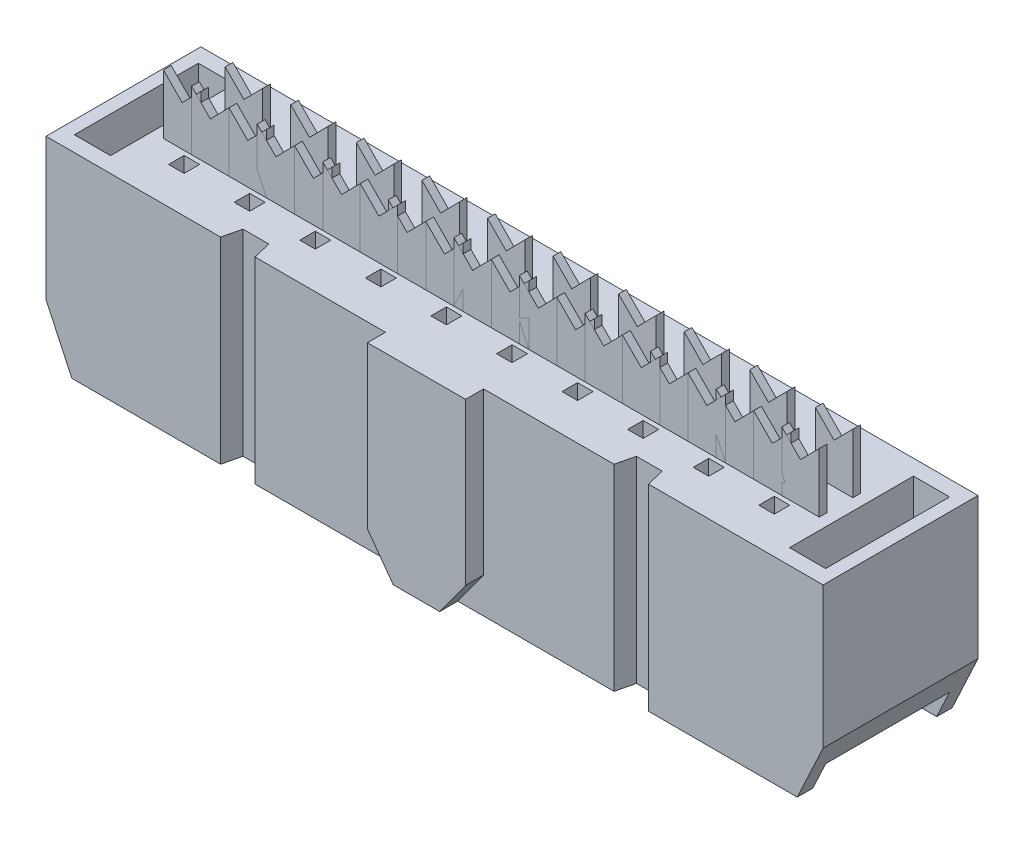
from build123d import *

# Parameters (mm, degrees)
SKETCH_10_W               = 1.4
SKETCH_10_H               = 4.8
SKETCH_10_W_2             = 0.6
SKETCH_10_H_2             = 0.6
EXTRUDE_4_DEPTH           = 7.62
CHAMFER_1_SIZE            = 2.144506921
CHAMFER_1_SIZE_2          = 1
CHAMFER_2_SIZE            = 1
CHAMFER_2_SIZE2           = 1.37638192
CHAMFER_4_SIZE            = 0.25
SKETCH_17_W               = 1.45
SKETCH_17_H               = 0.3
EXTRUDE_9_DEPTH           = 2.3
CUT_EXTRUDE_2_DEPTH       = 2.3
PATTERN_START             = 0.5
PATTERN_SKETCH_1_DEPTH    = 0.3
PATTERN_SKETCH_1_2_DEPTH  = 0.3
PATTERN_SKETCH_1_3_DEPTH  = 0.3
PATTERN_SKETCH_1_4_DEPTH  = 0.3
PATTERN_SKETCH_1_5_DEPTH  = 0.3
PATTERN_SKETCH_1_6_DEPTH  = 0.3
PATTERN_SKETCH_1_7_DEPTH  = 0.3
PATTERN_SKETCH_1_8_DEPTH  = 0.3
PATTERN_SKETCH_1_9_DEPTH  = 0.3
PATTERN_SKETCH_1_10_DEPTH = 0.3


# Read off the part's stored shape, not the designer's step: Эскиз-Массив1
with BuildPart() as part:
    # Эскиз10 → Бобышка-Вытянуть4 (new body)
    with BuildSketch(Plane(origin=(0, 0, 0), x_dir=(1, 0, 0), z_dir=(0, 1, 0))):
        Polygon((-15.05, -3), (-8.286666667, -3), (-8.12, -2.3), (-7.12, -2.3), (-6.953333333, -3), (-1.9, -3), (-1.9, -3.7), (1.9, -3.7), (1.9, -3), (6.953333333, -3), (7.12, -2.3), (8.12, -2.3), (8.286666667, -3), (15.05, -3), (15.05, 3), (-15.05, 3), align=None)
        with Locations((-13.85, 0)):
            Rectangle(SKETCH_10_W, SKETCH_10_H, mode=Mode.SUBTRACT)
        with Locations((-3.81, 1.27)):
            Rectangle(SKETCH_10_W_2, SKETCH_10_H_2, mode=Mode.SUBTRACT)
        with Locations((-1.27, 1.27)):
            Rectangle(SKETCH_10_W_2, SKETCH_10_H_2, mode=Mode.SUBTRACT)
        with Locations((-6.35, 1.27)):
            Rectangle(SKETCH_10_W_2, SKETCH_10_H_2, mode=Mode.SUBTRACT)
        with Locations((-8.89, 1.27)):
            Rectangle(SKETCH_10_W_2, SKETCH_10_H_2, mode=Mode.SUBTRACT)
        with Locations((-11.43, 1.27)):
            Rectangle(SKETCH_10_W_2, SKETCH_10_H_2, mode=Mode.SUBTRACT)
        with Locations((-11.43, -1.27)):
            Rectangle(SKETCH_10_W_2, SKETCH_10_H_2, mode=Mode.SUBTRACT)
        with Locations((-8.89, -1.27)):
            Rectangle(SKETCH_10_W_2, SKETCH_10_H_2, mode=Mode.SUBTRACT)
        with Locations((-6.35, -1.27)):
            Rectangle(SKETCH_10_W_2, SKETCH_10_H_2, mode=Mode.SUBTRACT)
        with Locations((-3.81, -1.27)):
            Rectangle(SKETCH_10_W_2, SKETCH_10_H_2, mode=Mode.SUBTRACT)
        with Locations((-1.27, -1.27)):
            Rectangle(SKETCH_10_W_2, SKETCH_10_H_2, mode=Mode.SUBTRACT)
        with Locations((3.81, -1.27)):
            Rectangle(SKETCH_10_W_2, SKETCH_10_H_2, mode=Mode.SUBTRACT)
        with Locations((1.27, -1.27)):
            Rectangle(SKETCH_10_W_2, SKETCH_10_H_2, mode=Mode.SUBTRACT)
        with Locations((6.35, -1.27)):
            Rectangle(SKETCH_10_W_2, SKETCH_10_H_2, mode=Mode.SUBTRACT)
        with Locations((8.89, -1.27)):
            Rectangle(SKETCH_10_W_2, SKETCH_10_H_2, mode=Mode.SUBTRACT)
        with Locations((11.43, -1.27)):
            Rectangle(SKETCH_10_W_2, SKETCH_10_H_2, mode=Mode.SUBTRACT)
        with Locations((11.43, 1.27)):
            Rectangle(SKETCH_10_W_2, SKETCH_10_H_2, mode=Mode.SUBTRACT)
        with Locations((8.89, 1.27)):
            Rectangle(SKETCH_10_W_2, SKETCH_10_H_2, mode=Mode.SUBTRACT)
        with Locations((6.35, 1.27)):
            Rectangle(SKETCH_10_W_2, SKETCH_10_H_2, mode=Mode.SUBTRACT)
        with Locations((3.81, 1.27)):
            Rectangle(SKETCH_10_W_2, SKETCH_10_H_2, mode=Mode.SUBTRACT)
        with Locations((1.27, 1.27)):
            Rectangle(SKETCH_10_W_2, SKETCH_10_H_2, mode=Mode.SUBTRACT)
        with Locations((13.85, 0)):
            Rectangle(SKETCH_10_W, SKETCH_10_H, mode=Mode.SUBTRACT)
    extrude(amount=EXTRUDE_4_DEPTH)

    # Фаска1
    # the kernel refuses this chamfer: 2.144506921, 1 mm, written as the material it takes off along each edge
    with BuildSketch(Plane(origin=(15.05, 0, 8.556364829), x_dir=(0.016311164131110077, 0.9998669641130705, 0), z_dir=(0, 0, -1)), Plane(origin=(-15.05, 0, -8.556364829), x_dir=(-0.016311164131110077, 0.9998669641130705, 0), z_dir=(0, 0, 1))) as chamfer_1_piece_1:
        Polygon((CHAMFER_1_SIZE * 0.999866963884, -CHAMFER_1_SIZE * 0.0163111641274), (-CHAMFER_1_SIZE_2 * 0.0163111641311, -CHAMFER_1_SIZE_2 * 0.999866964113), (0, 0), align=None)
    extrude(amount=17.112729659, mode=Mode.SUBTRACT)

    # Фаска2
    chamfer_2_edges = [part.edges().sort_by_distance(p)[0] for p in [
        (1.9, 0, 3.35),
        (-1.9, 0, 3.35),
    ]]
    chamfer_2_side = [part.faces().sort_by_distance(p)[0] for p in [
        (0, 0, 0.029621843),
    ]]
    chamfer(chamfer_2_edges, length=CHAMFER_2_SIZE, length2=CHAMFER_2_SIZE2, reference=chamfer_2_side[0])

    # Фаска4
    chamfer_4_edges = [part.edges().sort_by_distance(p)[0] for p in [
        (-8.59, 0, -1.27),
        (-8.89, 0, -1.57),
        (-9.19, 0, -1.27),
        (-8.89, 0, -0.97),
        (-11.13, 0, -1.27),
        (-11.43, 0, -1.57),
        (-11.73, 0, -1.27),
        (-11.43, 0, -0.97),
        (-9.19, 0, 1.27),
        (-8.89, 0, 1.57),
        (-8.59, 0, 1.27),
        (-8.89, 0, 0.97),
        (-6.65, 0, 1.27),
        (-6.35, 0, 1.57),
        (-6.05, 0, 1.27),
        (-6.35, 0, 0.97),
        (-4.11, 0, 1.27),
        (-3.81, 0, 1.57),
        (-3.51, 0, 1.27),
        (-3.81, 0, 0.97),
        (-1.57, 0, 1.27),
        (-1.27, 0, 1.57),
        (-0.97, 0, 1.27),
        (-1.27, 0, 0.97),
        (1.57, 0, 1.27),
        (1.27, 0, 0.97),
        (0.97, 0, 1.27),
        (1.27, 0, 1.57),
        (4.11, 0, 1.27),
        (3.81, 0, 0.97),
        (3.51, 0, 1.27),
        (3.81, 0, 1.57),
        (6.65, 0, 1.27),
        (6.35, 0, 0.97),
        (6.05, 0, 1.27),
        (6.35, 0, 1.57),
        (9.19, 0, 1.27),
        (8.89, 0, 0.97),
        (8.59, 0, 1.27),
        (8.89, 0, 1.57),
        (11.73, 0, 1.27),
        (11.43, 0, 0.97),
        (11.13, 0, 1.27),
        (11.43, 0, 1.57),
        (11.73, 0, -1.27),
        (11.43, 0, -1.57),
        (11.13, 0, -1.27),
        (11.43, 0, -0.97),
        (9.19, 0, -1.27),
        (8.89, 0, -1.57),
        (8.59, 0, -1.27),
        (8.89, 0, -0.97),
        (6.65, 0, -1.27),
        (6.35, 0, -1.57),
        (6.05, 0, -1.27),
        (6.35, 0, -0.97),
        (4.11, 0, -1.27),
        (3.81, 0, -1.57),
        (3.51, 0, -1.27),
        (3.81, 0, -0.97),
        (1.57, 0, -1.27),
        (1.27, 0, -1.57),
        (0.97, 0, -1.27),
        (1.27, 0, -0.97),
        (-11.73, 0, 1.27),
        (-11.43, 0, 1.57),
        (-11.13, 0, 1.27),
        (-11.43, 0, 0.97),
        (-3.51, 0, -1.27),
        (-3.81, 0, -1.57),
        (-4.11, 0, -1.27),
        (-3.81, 0, -0.97),
        (-0.97, 0, -1.27),
        (-1.27, 0, -1.57),
        (-1.57, 0, -1.27),
        (-1.27, 0, -0.97),
        (-6.05, 0, -1.27),
        (-6.35, 0, -1.57),
        (-6.65, 0, -1.27),
        (-6.35, 0, -0.97),
    ]]
    chamfer(chamfer_4_edges, length=CHAMFER_4_SIZE)


with BuildPart() as body_2:
    # Эскиз17 → Бобышка-Вытянуть9 (new body)
    with BuildSketch(Plane(origin=(0, 7.62, 0), x_dir=(1, 0, 0), z_dir=(0, 1, 0))):
        with Locations((0.725, -0.65)):
            Rectangle(SKETCH_17_W, SKETCH_17_H)
    extrude(amount=EXTRUDE_9_DEPTH)

    # Эскиз18 → Вырез-Вытянуть2 (cut)
    with BuildSketch(Plane.XY.offset(0.8)):
        Polygon((0, 9.92), (0.725, 9.184515736), (1.45, 9.92), align=None)
    extrude(amount=-CUT_EXTRUDE_2_DEPTH, mode=Mode.SUBTRACT)


with BuildPart() as body_3:
    # Эскиз-Массив1 outline → Эскиз-Массив1 (new body)
    with BuildSketch(Plane.XY.offset(PATTERN_START)):
        Polygon((-12.7, 7.62), (-11.25, 7.62), (-11.25, 9.92), (-11.975, 9.184515736), (-12.7, 9.92), align=None)
    extrude(amount=PATTERN_SKETCH_1_DEPTH)


with BuildPart() as body_4:
    # Pattern Sketch 1 2 outline → Pattern Sketch 1 2 (new body)
    with BuildSketch(Plane.XY.offset(PATTERN_START)):
        Polygon((-10.16, 7.62), (-8.71, 7.62), (-8.71, 9.92), (-9.435, 9.184515736), (-10.16, 9.92), align=None)
    extrude(amount=PATTERN_SKETCH_1_2_DEPTH)


with BuildPart() as body_5:
    # Pattern Sketch 1 3 outline → Pattern Sketch 1 3 (new body)
    with BuildSketch(Plane.XY.offset(PATTERN_START)):
        Polygon((-7.62, 7.62), (-6.17, 7.62), (-6.17, 9.92), (-6.895, 9.184515736), (-7.62, 9.92), align=None)
    extrude(amount=PATTERN_SKETCH_1_3_DEPTH)


with BuildPart() as body_6:
    # Pattern Sketch 1 4 outline → Pattern Sketch 1 4 (new body)
    with BuildSketch(Plane.XY.offset(PATTERN_START)):
        Polygon((-5.08, 7.62), (-3.63, 7.62), (-3.63, 9.92), (-4.355, 9.184515736), (-5.08, 9.92), align=None)
    extrude(amount=PATTERN_SKETCH_1_4_DEPTH)


with BuildPart() as body_7:
    # Pattern Sketch 1 5 outline → Pattern Sketch 1 5 (new body)
    with BuildSketch(Plane.XY.offset(PATTERN_START)):
        Polygon((-2.54, 7.62), (-1.09, 7.62), (-1.09, 9.92), (-1.815, 9.184515736), (-2.54, 9.92), align=None)
    extrude(amount=PATTERN_SKETCH_1_5_DEPTH)


with BuildPart() as body_8:
    # Pattern Sketch 1 6 outline → Pattern Sketch 1 6 (new body)
    with BuildSketch(Plane.XY.offset(PATTERN_START)):
        Polygon((7.62, 7.62), (9.07, 7.62), (9.07, 9.92), (8.345, 9.184515736), (7.62, 9.92), align=None)
    extrude(amount=PATTERN_SKETCH_1_6_DEPTH)


with BuildPart() as body_9:
    # Pattern Sketch 1 7 outline → Pattern Sketch 1 7 (new body)
    with BuildSketch(Plane.XY.offset(PATTERN_START)):
        Polygon((10.16, 7.62), (11.61, 7.62), (11.61, 9.92), (10.885, 9.184515736), (10.16, 9.92), align=None)
    extrude(amount=PATTERN_SKETCH_1_7_DEPTH)


with BuildPart() as body_10:
    # Pattern Sketch 1 8 outline → Pattern Sketch 1 8 (new body)
    with BuildSketch(Plane.XY.offset(PATTERN_START)):
        Polygon((5.08, 7.62), (6.53, 7.62), (6.53, 9.92), (5.805, 9.184515736), (5.08, 9.92), align=None)
    extrude(amount=PATTERN_SKETCH_1_8_DEPTH)


with BuildPart() as body_11:
    # Pattern Sketch 1 9 outline → Pattern Sketch 1 9 (new body)
    with BuildSketch(Plane.XY.offset(PATTERN_START)):
        Polygon((2.54, 7.62), (3.99, 7.62), (3.99, 9.92), (3.265, 9.184515736), (2.54, 9.92), align=None)
    extrude(amount=PATTERN_SKETCH_1_9_DEPTH)


with BuildPart() as body_12:
    # Pattern Sketch 1 10 outline → Pattern Sketch 1 10 (new body)
    with BuildSketch(Plane.XY.offset(PATTERN_START)):
        Polygon((0, 7.62), (1.45, 7.62), (1.45, 9.92), (0.725, 9.184515736), (0, 9.92), align=None)
    extrude(amount=PATTERN_SKETCH_1_10_DEPTH)


with BuildPart() as body_13:
    # Зеркальное отражение1: mirrored copy
    add(body_3.part.mirror(Plane(origin=(0, 0, 0), x_dir=(0, 0, 1), z_dir=(1, 0, 0))))


with BuildPart() as body_14:
    # Mirror 1 2: mirrored copy
    add(body_4.part.mirror(Plane(origin=(0, 0, 0), x_dir=(0, 0, 1), z_dir=(1, 0, 0))))


with BuildPart() as body_15:
    # Mirror 1 3: mirrored copy
    add(body_5.part.mirror(Plane(origin=(0, 0, 0), x_dir=(0, 0, 1), z_dir=(1, 0, 0))))


with BuildPart() as body_16:
    # Mirror 1 4: mirrored copy
    add(body_6.part.mirror(Plane(origin=(0, 0, 0), x_dir=(0, 0, 1), z_dir=(1, 0, 0))))


with BuildPart() as body_17:
    # Mirror 1 5: mirrored copy
    add(body_7.part.mirror(Plane(origin=(0, 0, 0), x_dir=(0, 0, 1), z_dir=(1, 0, 0))))


with BuildPart() as body_18:
    # Mirror 1 6: mirrored copy
    add(body_2.part.mirror(Plane(origin=(0, 0, 0), x_dir=(0, 0, 1), z_dir=(1, 0, 0))))


with BuildPart() as body_19:
    # Mirror 1 7: mirrored copy
    add(body_11.part.mirror(Plane(origin=(0, 0, 0), x_dir=(0, 0, 1), z_dir=(1, 0, 0))))


with BuildPart() as body_20:
    # Mirror 1 8: mirrored copy
    add(body_10.part.mirror(Plane(origin=(0, 0, 0), x_dir=(0, 0, 1), z_dir=(1, 0, 0))))


with BuildPart() as body_21:
    # Mirror 1 9: mirrored copy
    add(body_8.part.mirror(Plane(origin=(0, 0, 0), x_dir=(0, 0, 1), z_dir=(1, 0, 0))))


with BuildPart() as body_22:
    # Mirror 1 10: mirrored copy
    add(body_9.part.mirror(Plane(origin=(0, 0, 0), x_dir=(0, 0, 1), z_dir=(1, 0, 0))))


with BuildPart() as body_23:
    # Зеркальное отражение2: mirrored copy
    add(body_22.part.mirror(Plane.XY))


with BuildPart() as body_24:
    # Mirror 2 2: mirrored copy
    add(body_21.part.mirror(Plane.XY))


with BuildPart() as body_25:
    # Mirror 2 3: mirrored copy
    add(body_20.part.mirror(Plane.XY))


with BuildPart() as body_26:
    # Mirror 2 4: mirrored copy
    add(body_19.part.mirror(Plane.XY))


with BuildPart() as body_27:
    # Mirror 2 5: mirrored copy
    add(body_18.part.mirror(Plane.XY))


with BuildPart() as body_28:
    # Mirror 2 6: mirrored copy
    add(body_17.part.mirror(Plane.XY))


with BuildPart() as body_29:
    # Mirror 2 7: mirrored copy
    add(body_16.part.mirror(Plane.XY))


with BuildPart() as body_30:
    # Mirror 2 8: mirrored copy
    add(body_15.part.mirror(Plane.XY))


with BuildPart() as body_31:
    # Mirror 2 9: mirrored copy
    add(body_14.part.mirror(Plane.XY))


with BuildPart() as body_32:
    # Mirror 2 10: mirrored copy
    add(body_13.part.mirror(Plane.XY))


solid = Compound([part.part, body_2.part, body_3.part, body_4.part, body_5.part, body_6.part, body_7.part, body_8.part, body_9.part, body_10.part, body_11.part, body_12.part, body_13.part, body_14.part, body_15.part, body_16.part, body_17.part, body_18.part, body_19.part, body_20.part, body_21.part, body_22.part, body_23.part, body_24.part, body_25.part, body_26.part, body_27.part, body_28.part, body_29.part, body_30.part, body_31.part, body_32.part])
